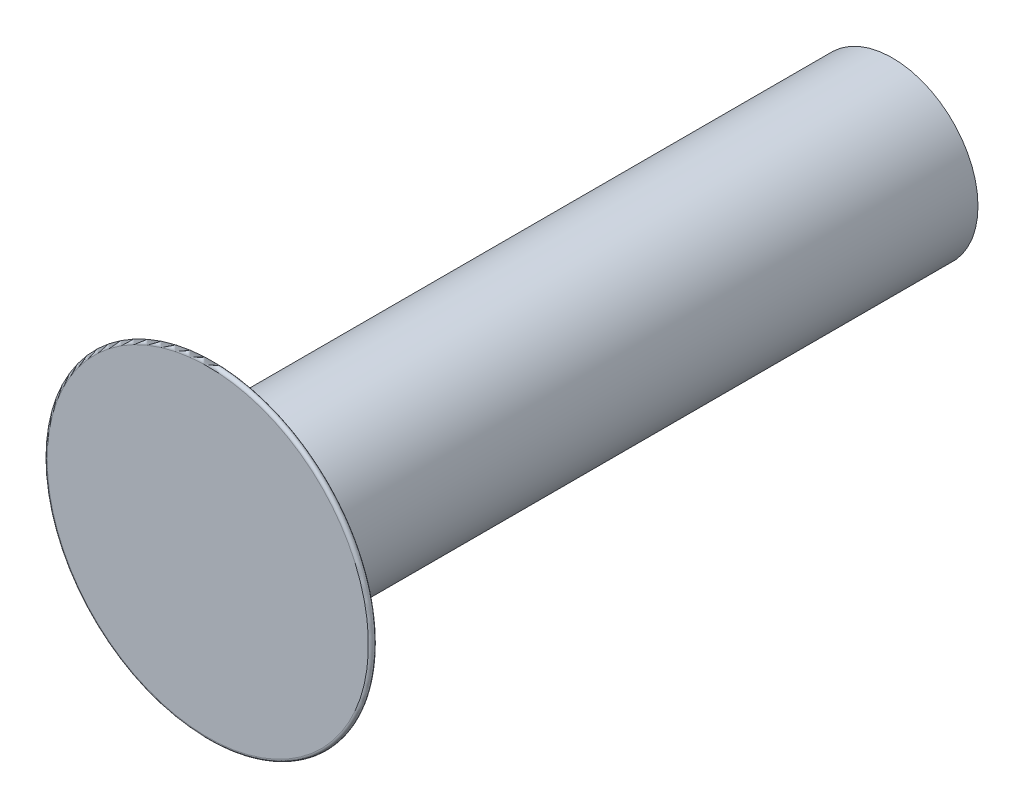
from build123d import *

# Parameters (mm, degrees)
FILLET_2_R = 0.105833333


with BuildPart() as part:
    # BaseBodySke → BaseBody (revolve)
    with BuildSketch(Plane(origin=(0, 0, 0), x_dir=(1, 0, 0), z_dir=(0, 1, 0))):
        Polygon((0, 0), (-6.35, 0), (-3.175, 1.8542), (-3.175, 25.4), (0, 25.4), align=None)
    revolve(axis=Axis((0, 0, 0), (0, 0, -1)))

    # Fillet 2
    fillet_2_edges = [part.edges().sort_by_distance(p)[0] for p in [
        (6.35, 0, 0),
    ]]
    fillet(fillet_2_edges, radius=FILLET_2_R)


solid = part.part
